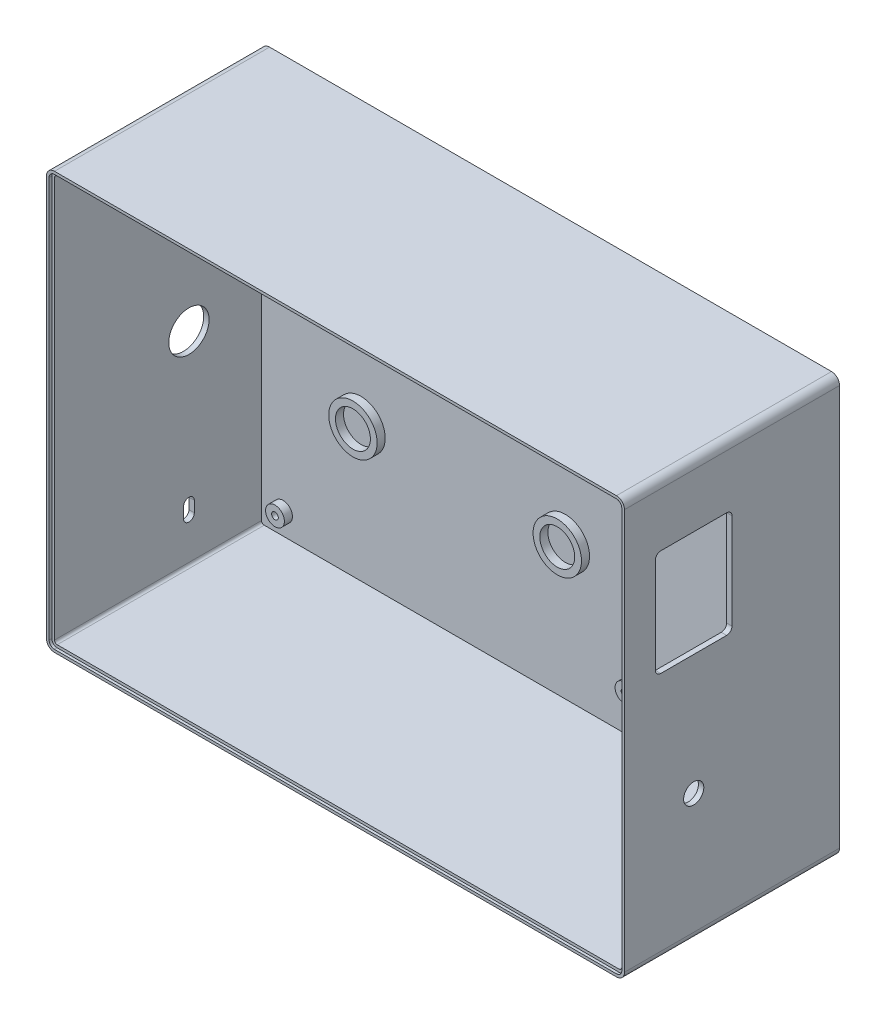
from build123d import *

# Parameters (mm, degrees)
SKETCH_1_W          = 215
SKETCH_1_H          = 155
EXTRUDE_1_DEPTH     = 80
FILLET_1_R          = 3
SHELL_1_T           = -2
SKETCH_2_R          = 3.5
SKETCH_2_R_2        = 1.25
EXTRUDE_2_DEPTH     = 5
SKETCH_3_R          = 9
SKETCH_3_R_2        = 6.5
EXTRUDE_3_DEPTH     = 3
SKETCH_4_W          = 28.5
SKETCH_4_H          = 39.5
CUT_EXTRUDE_3_DEPTH = 3
FILLET_2_R          = 2
SKETCH_5_R          = 7.5
CUT_EXTRUDE_4_DEPTH = 3
SKETCH_6_R          = 3.75
CUT_EXTRUDE_5_DEPTH = 3
CUT_EXTRUDE_6_DEPTH = 3
CUT_EXTRUDE_7_DEPTH = 1
SKETCH_9_R          = 3.5
EXTRUDE_4_DEPTH     = 3
SKETCH_10_R         = 1.25
CUT_EXTRUDE_8_DEPTH = 5


with BuildPart() as part:
    # 草图1 → 凸台-拉伸1 (new body)
    with BuildSketch(Plane.XY):
        with Locations((107.5, -77.5)):
            Rectangle(SKETCH_1_W, SKETCH_1_H)
    extrude(amount=EXTRUDE_1_DEPTH)

    # 圆角1
    fillet_1_edges = [part.edges().sort_by_distance(p)[0] for p in [
        (0, -155, 40),
        (215, -155, 40),
        (215, 0, 40),
        (0, 0, 40),
    ]]
    fillet(fillet_1_edges, radius=FILLET_1_R)

    # 抽壳1
    shell_1_openings = [part.faces().sort_by_distance(p)[0] for p in [
        (107.5, -77.5, 80),
    ]]
    offset(amount=SHELL_1_T, openings=shell_1_openings, kind=Kind.INTERSECTION)

    # 草图2 → 凸台-拉伸2 (add)
    # profile 1 of 4: a face of its own
    with BuildSketch(Plane.XY.offset(2)):
        with Locations((207, -20)):
            Circle(SKETCH_2_R)
        with Locations((207, -20)):
            Circle(SKETCH_2_R_2, mode=Mode.SUBTRACT)
    # profile 2 of 4: a face of its own
    with BuildSketch(Plane.XY.offset(2)):
        with Locations((142, -20)):
            Circle(SKETCH_2_R)
        with Locations((142, -20)):
            Circle(SKETCH_2_R_2, mode=Mode.SUBTRACT)
    # profile 3 of 4: a face of its own
    with BuildSketch(Plane.XY.offset(2)):
        with Locations((142, -135)):
            Circle(SKETCH_2_R)
        with Locations((142, -135)):
            Circle(SKETCH_2_R_2, mode=Mode.SUBTRACT)
    # profile 4 of 4: a face of its own
    with BuildSketch(Plane.XY.offset(2)):
        with Locations((207, -135)):
            Circle(SKETCH_2_R)
        with Locations((207, -135)):
            Circle(SKETCH_2_R_2, mode=Mode.SUBTRACT)
    extrude(amount=EXTRUDE_2_DEPTH)

    # 草图3 → 凸台-拉伸3 (add)
    # profile 1 of 4: a face of its own
    with BuildSketch(Plane.XY.offset(2)):
        with Locations((115, -52.5)):
            Circle(SKETCH_3_R)
        with Locations((115, -52.5)):
            Circle(SKETCH_3_R_2, mode=Mode.SUBTRACT)
    # profile 2 of 4: a face of its own
    with BuildSketch(Plane.XY.offset(2)):
        with Locations((39, -52.5)):
            Circle(SKETCH_3_R)
        with Locations((39, -52.5)):
            Circle(SKETCH_3_R_2, mode=Mode.SUBTRACT)
    # profile 3 of 4: a face of its own
    with BuildSketch(Plane.XY.offset(2)):
        with Locations((39, -102.5)):
            Circle(SKETCH_3_R)
        with Locations((39, -102.5)):
            Circle(SKETCH_3_R_2, mode=Mode.SUBTRACT)
    # profile 4 of 4: a face of its own
    with BuildSketch(Plane.XY.offset(2)):
        with Locations((115, -102.5)):
            Circle(SKETCH_3_R)
        with Locations((115, -102.5)):
            Circle(SKETCH_3_R_2, mode=Mode.SUBTRACT)
    extrude(amount=EXTRUDE_3_DEPTH)

    # 草图4 → 切除-拉伸3 (cut)
    with BuildSketch(Plane(origin=(215, 0, 0), x_dir=(0, 0, -1), z_dir=(1, 0, 0))):
        with Locations((-54.25, -42.75)):
            Rectangle(SKETCH_4_W, SKETCH_4_H)
    extrude(amount=-CUT_EXTRUDE_3_DEPTH, mode=Mode.SUBTRACT)

    # 圆角2
    fillet_2_edges = [part.edges().sort_by_distance(p)[0] for p in [
        (214, -62.5, 40),
        (214, -62.5, 68.5),
        (214, -23, 68.5),
        (214, -23, 40),
    ]]
    fillet(fillet_2_edges, radius=FILLET_2_R)

    # 草图5 → 切除-拉伸4 (cut)
    with BuildSketch(Plane.ZY):
        with Locations((29, -77.5)):
            Circle(SKETCH_5_R)
    extrude(amount=-CUT_EXTRUDE_4_DEPTH, mode=Mode.SUBTRACT)

    # 草图6 → 切除-拉伸5 (cut)
    with BuildSketch(Plane(origin=(215, 0, 0), x_dir=(0, 0, -1), z_dir=(1, 0, 0))):
        with Locations((-54.25, -107.25)):
            Circle(SKETCH_6_R)
    extrude(amount=-CUT_EXTRUDE_5_DEPTH, mode=Mode.SUBTRACT)

    # 草图7 → 切除-拉伸6 (cut)
    with BuildSketch(Plane.ZY):
        with BuildLine():
            Line((31, -133), (31, -137))
            ThreePointArc((31, -137), (29, -139), (27, -137))
            Line((27, -137), (27, -133))
            ThreePointArc((27, -133), (29, -131), (31, -133))
        make_face()
    extrude(amount=-CUT_EXTRUDE_6_DEPTH, mode=Mode.SUBTRACT)

    # 草图8 → 切除-拉伸7 (cut)
    with BuildSketch(Plane.XY.offset(80)):
        with BuildLine():
            Line((3, -154), (212, -154))
            ThreePointArc((212, -154), (213.414213562, -153.414213562), (214, -152))
            Line((214, -152), (214, -3))
            ThreePointArc((214, -3), (213.414213562, -1.585786438), (212, -1))
            Line((212, -1), (3, -1))
            ThreePointArc((3, -1), (1.585786438, -1.585786438), (1, -3))
            Line((1, -3), (1, -152))
            ThreePointArc((1, -152), (1.585786438, -153.414213562), (3, -154))
        make_face()
        with BuildLine():
            Line((3, -153), (212, -153))
            ThreePointArc((212, -153), (212.707106781, -152.707106781), (213, -152))
            Line((213, -152), (213, -3))
            ThreePointArc((213, -3), (212.707106781, -2.292893219), (212, -2))
            Line((212, -2), (3, -2))
            ThreePointArc((3, -2), (2.292893219, -2.292893219), (2, -3))
            Line((2, -3), (2, -152))
            ThreePointArc((2, -152), (2.292893219, -152.707106781), (3, -153))
        make_face(mode=Mode.SUBTRACT)
    extrude(amount=-CUT_EXTRUDE_7_DEPTH, mode=Mode.SUBTRACT)

    # 草图9 → 凸台-拉伸4 (add)
    with BuildSketch(Plane.XY.offset(2)):
        with Locations((10, -10)):
            Circle(SKETCH_9_R)
        with Locations((205, -10)):
            Circle(SKETCH_9_R)
        with Locations((205, -145)):
            Circle(SKETCH_9_R)
        with Locations((10, -145)):
            Circle(SKETCH_9_R)
    extrude(amount=EXTRUDE_4_DEPTH)

    # 草图10 → 切除-拉伸8 (cut)
    with BuildSketch(Plane.XY.offset(5)):
        with Locations((10, -10)):
            Circle(SKETCH_10_R)
        with Locations((205, -10)):
            Circle(SKETCH_10_R)
        with Locations((205, -145)):
            Circle(SKETCH_10_R)
        with Locations((10, -145)):
            Circle(SKETCH_10_R)
    extrude(amount=-CUT_EXTRUDE_8_DEPTH, mode=Mode.SUBTRACT)


solid = part.part
